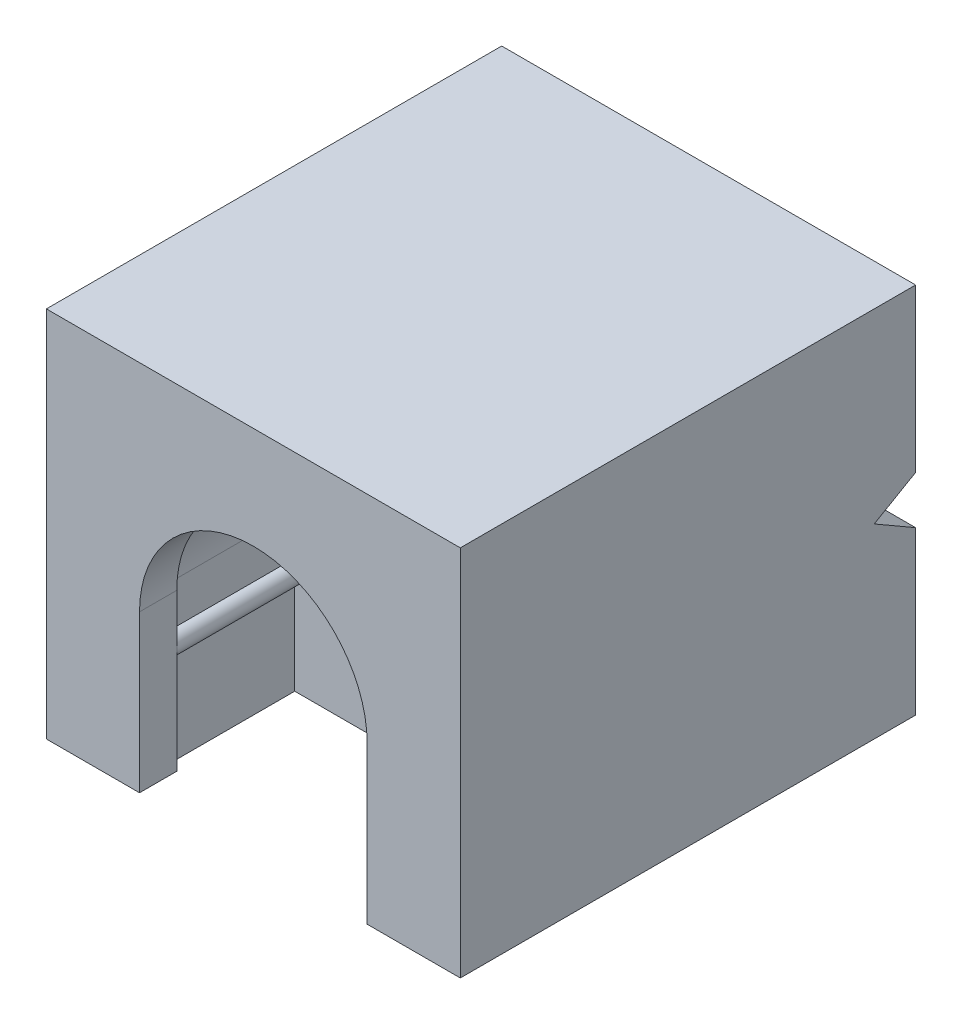
from build123d import *

# Parameters (mm, degrees)
BOSS_EXTRUDE1_DEPTH = 4
SKETCH2_W           = 10
SKETCH2_H           = 9
BOSS_EXTRUDE2_DEPTH = 7
SKETCH3_R           = 0.75
CUT_EXTRUDE1_DEPTH  = 6
CUT_EXTRUDE3_REACH  = 15.273
BOSS_EXTRUDE3_START = -1
BOSS_EXTRUDE3_DEPTH = 1
CHAMFER1_SIZE       = 0.1


with BuildPart() as part:
    # Sketch1 → Boss-Extrude1 (new body)
    with BuildSketch(Plane.XY):
        with BuildLine():
            Line((-3, -3.786060838), (-3, -1.49999581))
            ThreePointArc((-3, -1.49999581), (-2.791987509, -1.388670983), (-2.769230655, -1.153842239))
            ThreePointArc((-2.769230655, -1.153842239), (-2.861324827, -1.041983319), (-3, -0.99999581))
            Line((-3, -0.99999581), (-3, 0))
            ThreePointArc((-3, 0), (0, 3), (3, 0))
            Line((3, 0), (3, -0.99999581))
            ThreePointArc((3, -0.99999581), (2.861324827, -1.041983319), (2.769230655, -1.153842239))
            ThreePointArc((2.769230655, -1.153842239), (2.791987509, -1.388670983), (3, -1.49999581))
            Line((3, -1.49999581), (3, -3.786060838))
            Line((3, -3.786060838), (5, -3.786060838))
            Line((5, -3.786060838), (5, 5.213939162))
            Line((5, 5.213939162), (-5, 5.213939162))
            Line((-5, 5.213939162), (-5, -3.786060838))
            Line((-5, -3.786060838), (-3, -3.786060838))
        make_face()
    extrude(amount=BOSS_EXTRUDE1_DEPTH)

    # Sketch2 → Boss-Extrude2 (add)
    with BuildSketch(Plane.XY):
        with Locations((0, 0.713939162)):
            Rectangle(SKETCH2_W, SKETCH2_H)
    extrude(amount=-BOSS_EXTRUDE2_DEPTH)

    # Sketch3 → Cut-Extrude1 (cut)
    with BuildSketch(Plane(origin=(0, 0, -7), x_dir=(-1, 0, 0), z_dir=(0, 0, -1))):
        with Locations((0, 0.713939162)):
            Circle(SKETCH3_R)
    extrude(amount=-CUT_EXTRUDE1_DEPTH, mode=Mode.SUBTRACT)

    # Cut-Extrude3: up to this face of the body (flat: up to its plane)
    cut_extrude3_end = Plane(part.part.faces().sort_by_distance((-5, 0.713939162, -1.5))[0])
    # Sketch4 → Cut-Extrude3 (cut, up to the picked face)
    with BuildSketch(Plane(origin=(5, 0, 0), x_dir=(0, 0, -1), z_dir=(1, 0, 0)), mode=Mode.PRIVATE) as cut_extrude3_sk1:
        Polygon((7.5, -0.152086242), (7.5, 1.579964565), (6, 0.713939162), align=None)
    cut_extrude3_tool1 = split(extrude(cut_extrude3_sk1.sketch, amount=-CUT_EXTRUDE3_REACH, mode=Mode.PRIVATE), bisect_by=cut_extrude3_end, keep=Keep.BOTH, mode=Mode.PRIVATE)
    add(cut_extrude3_tool1.solids().sort_by(Axis((5, 0.713939, -7), (-1, 0, 0)))[0], mode=Mode.SUBTRACT)

    # Sketch5 → Boss-Extrude3 (add)
    with BuildSketch(Plane.XY.offset(4).offset(BOSS_EXTRUDE3_START)):
        with BuildLine():
            ThreePointArc((3, 0), (0, 3), (-3, 0))
            Line((-3, 0), (-3, -3.786060838))
            Line((-3, -3.786060838), (-2.75, -3.786060838))
            Line((-2.75, -3.786060838), (-2.75, 0))
            ThreePointArc((-2.75, 0), (0, 2.75), (2.75, 0))
            Line((2.75, 0), (2.75, -3.786060838))
            Line((2.75, -3.786060838), (3, -3.786060838))
            Line((3, -3.786060838), (3, 0))
        make_face()
    extrude(amount=BOSS_EXTRUDE3_DEPTH)

    # Chamfer1
    # the kernel refuses this chamfer: 0.1 mm, written as the material it takes off along each edge
    with BuildSketch(Plane(origin=(2.75, -1.24999581, 3), x_dir=(-0.027495876610587302, 0, 0.9996219169112966), z_dir=(0, -1, 0))) as chamfer1_piece_1_section:
        Polygon((CHAMFER1_SIZE * 0.999621916911, -CHAMFER1_SIZE * 0.0274958766106), (-CHAMFER1_SIZE * 0.0274958766106, -CHAMFER1_SIZE * 0.999621916911), (0, 0), align=None)
    chamfer1_piece_1 = extrude(amount=2.793233327, mode=Mode.PRIVATE)
    chamfer1_piece_1 = chamfer1_piece_1 - Plane(origin=(3, -1.24999581, 3.033543391), x_dir=(0, 1, 0), z_dir=(0, 0, -1)) * Cylinder(0.25, 6, mode=Mode.PRIVATE)
    add(chamfer1_piece_1, mode=Mode.SUBTRACT)
    with BuildSketch(Plane(origin=(-2.75, -4.043229137, 3), x_dir=(-0.9996219169112966, 0, -0.027495876610587302), z_dir=(0, 1, 0))) as chamfer1_piece_2_section:
        Polygon((CHAMFER1_SIZE * 0.999621916911, CHAMFER1_SIZE * 0.0274958766106), (-CHAMFER1_SIZE * 0.0274958766106, CHAMFER1_SIZE * 0.999621916911), (0, 0), align=None)
    chamfer1_piece_2 = extrude(amount=2.793233327, mode=Mode.PRIVATE)
    chamfer1_piece_2 = chamfer1_piece_2 - Plane(origin=(-3, -1.24999581, 3.033543414), x_dir=(0, -1, 0), z_dir=(0, 0, -1)) * Cylinder(0.25, 6, mode=Mode.PRIVATE)
    add(chamfer1_piece_2, mode=Mode.SUBTRACT)
    with BuildSketch(Plane(origin=(2.75, 0, 3), x_dir=(-0.027495876610587302, 0, 0.9996219169112966), z_dir=(0, -1, 0))) as chamfer1_piece_3_section:
        Polygon((CHAMFER1_SIZE * 0.999621916911, -CHAMFER1_SIZE * 0.0274958766106), (-CHAMFER1_SIZE * 0.0274958766106, -CHAMFER1_SIZE * 0.999621916911), (0, 0), align=None)
    chamfer1_piece_3 = extrude(amount=1.24999581, mode=Mode.PRIVATE)
    chamfer1_piece_3 = chamfer1_piece_3 - Plane(origin=(3, -1.24999581, 3.033781207), x_dir=(0, 1, 0), z_dir=(0, 0, -1)) * Cylinder(0.25, 3, mode=Mode.PRIVATE)
    add(chamfer1_piece_3, mode=Mode.SUBTRACT)
    with BuildSketch(Plane(origin=(0, 0, 3), x_dir=(-1, 0, 0), z_dir=(0, -1, 0))) as chamfer1_piece_4:
        Polygon((2.75, -CHAMFER1_SIZE), (2.75 + CHAMFER1_SIZE, 0), (2.75, 0), align=None)
    revolve(axis=Axis((0, 0, 3), (0, 0, -1)), revolution_arc=180, mode=Mode.SUBTRACT)
    with BuildSketch(Plane(origin=(-2.75, -1.24999581, 3), x_dir=(-0.9996219169112966, 0, -0.027495876610587302), z_dir=(0, 1, 0))) as chamfer1_piece_5_section:
        Polygon((CHAMFER1_SIZE * 0.999621916911, CHAMFER1_SIZE * 0.0274958766106), (-CHAMFER1_SIZE * 0.0274958766106, CHAMFER1_SIZE * 0.999621916911), (0, 0), align=None)
    chamfer1_piece_5 = extrude(amount=1.24999581, mode=Mode.PRIVATE)
    chamfer1_piece_5 = chamfer1_piece_5 - Plane(origin=(-3, -1.24999581, 3.033781195), x_dir=(0, -1, 0), z_dir=(0, 0, -1)) * Cylinder(0.25, 3, mode=Mode.PRIVATE)
    add(chamfer1_piece_5, mode=Mode.SUBTRACT)


solid = part.part
